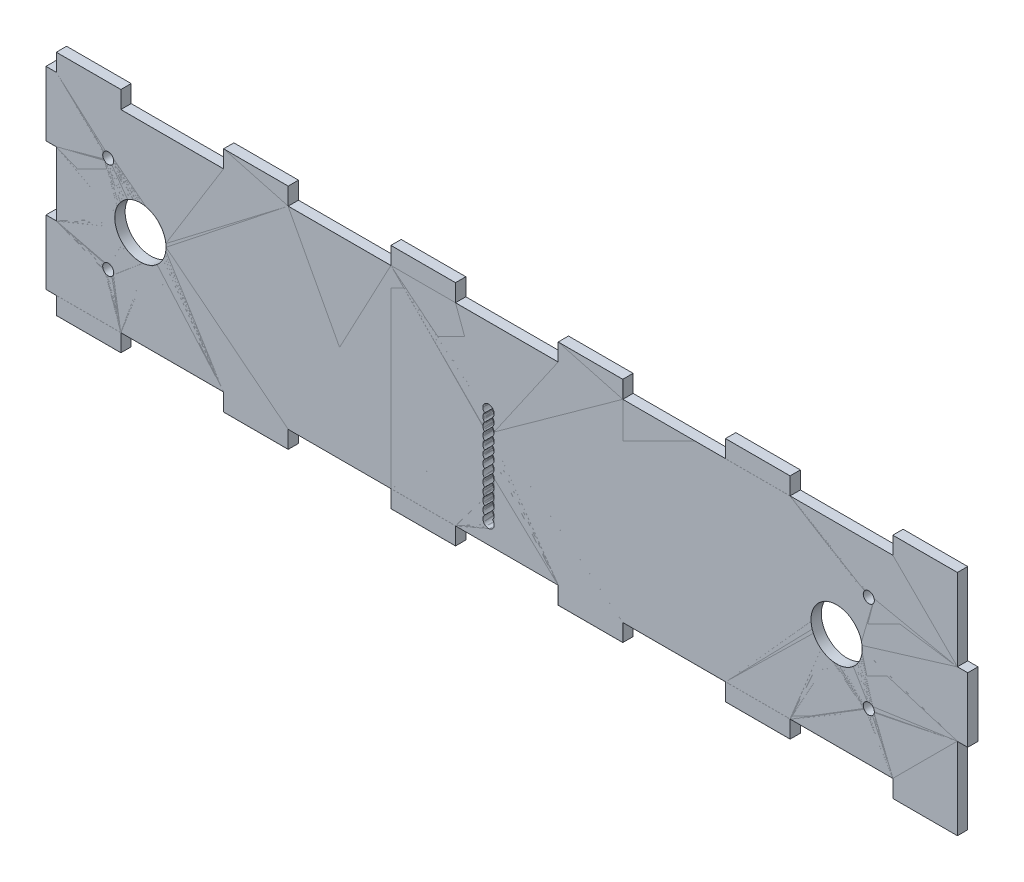
from build123d import *

# Parameters (mm, degrees)
BOSS_EXTRUDE1_OUTLINE_R   = 1.755
BOSS_EXTRUDE1_OUTLINE_R_2 = 8
BOSS_EXTRUDE1_DEPTH       = 3.175
SKETCH4_R                 = 1.71436
SKETCH4_R_2               = 7.95936
BOSS_EXTRUDE3_DEPTH       = 3.2


# Read off the part's stored shape, not the designer's step: Boss-Extrude1
with BuildPart() as part:
    # Boss-Extrude1 outline → Boss-Extrude1 (new body)
    with BuildSketch(Plane.XY):
        Polygon((-140, 35.4), (-140, 30), (-143.2, 30), (-143.2, 10), (-140, 10), (-140, -10), (-143.2, -10), (-143.2, -30), (-140, -30), (-140, -35.4), (-120, -35.4), (-120, -30), (-88, -30), (-88, -35.4), (-68, -35.4), (-68, -30), (-36, -30), (-36, -35.4), (-16, -35.4), (-16, -30), (16, -30), (16, -35.4), (36, -35.4), (36, -30), (68, -30), (68, -35.4), (88, -35.4), (88, -30), (120, -30), (120, -35.4), (140, -35.4), (140, -10), (143.2, -10), (143.2, 10), (140, 10), (140, 35.4), (120, 35.4), (120, 30), (88, 30), (88, 35.4), (68, 35.4), (68, 30), (36, 30), (36, 35.4), (16, 35.4), (16, 30), (-16, 30), (-16, 35.4), (-36, 35.4), (-36, 30), (-68, 30), (-68, 35.4), (-88, 35.4), (-88, 30), (-120, 30), (-120, 35.4), align=None)
        with Locations((-123.9, -15)):
            Circle(BOSS_EXTRUDE1_OUTLINE_R, mode=Mode.SUBTRACT)
        with BuildLine():
            ThreePointArc((-4.475255129, -20.1), (-3.95, -21.35), (-4.475255129, -22.6))
            ThreePointArc((-4.475255129, -22.6), (-5.7, -25.6), (-6.924744871, -22.6))
            ThreePointArc((-6.924744871, -22.6), (-7.45, -21.35), (-6.924744871, -20.1))
            ThreePointArc((-6.924744871, -20.1), (-7.45, -18.85), (-6.924744871, -17.6))
            ThreePointArc((-6.924744871, -17.6), (-7.45, -16.35), (-6.924744871, -15.1))
            ThreePointArc((-6.924744871, -15.1), (-7.45, -13.85), (-6.924744871, -12.6))
            ThreePointArc((-6.924744871, -12.6), (-7.45, -11.35), (-6.924744871, -10.1))
            ThreePointArc((-6.924744871, -10.1), (-7.45, -8.85), (-6.924744871, -7.6))
            ThreePointArc((-6.924744871, -7.6), (-7.45, -6.35), (-6.924744871, -5.1))
            ThreePointArc((-6.924744871, -5.1), (-7.45, -3.85), (-6.924744871, -2.6))
            ThreePointArc((-6.924744871, -2.6), (-7.45, -1.35), (-6.924744871, -0.1))
            ThreePointArc((-6.924744871, -0.1), (-7.45, 1.15), (-6.924744871, 2.4))
            ThreePointArc((-6.924744871, 2.4), (-7.45, 3.65), (-6.924744871, 4.9))
            ThreePointArc((-6.924744871, 4.9), (-5.7, 7.9), (-4.475255129, 4.9))
            ThreePointArc((-4.475255129, 4.9), (-3.95, 3.65), (-4.475255129, 2.4))
            ThreePointArc((-4.475255129, 2.4), (-3.95, 1.15), (-4.475255129, -0.1))
            ThreePointArc((-4.475255129, -0.1), (-3.95, -1.35), (-4.475255129, -2.6))
            ThreePointArc((-4.475255129, -2.6), (-3.95, -3.85), (-4.475255129, -5.1))
            ThreePointArc((-4.475255129, -5.1), (-3.95, -6.35), (-4.475255129, -7.6))
            ThreePointArc((-4.475255129, -7.6), (-3.95, -8.85), (-4.475255129, -10.1))
            ThreePointArc((-4.475255129, -10.1), (-3.95, -11.35), (-4.475255129, -12.6))
            ThreePointArc((-4.475255129, -12.6), (-3.95, -13.85), (-4.475255129, -15.1))
            ThreePointArc((-4.475255129, -15.1), (-3.95, -16.35), (-4.475255129, -17.6))
            ThreePointArc((-4.475255129, -17.6), (-3.95, -18.85), (-4.475255129, -20.1))
        make_face(mode=Mode.SUBTRACT)
        with Locations((112.5, -15)):
            Circle(BOSS_EXTRUDE1_OUTLINE_R, mode=Mode.SUBTRACT)
        with Locations((-113.9, 0)):
            Circle(BOSS_EXTRUDE1_OUTLINE_R_2, mode=Mode.SUBTRACT)
        with Locations((-123.9, 15)):
            Circle(BOSS_EXTRUDE1_OUTLINE_R, mode=Mode.SUBTRACT)
        with Locations((102.5, 0)):
            Circle(BOSS_EXTRUDE1_OUTLINE_R_2, mode=Mode.SUBTRACT)
        with Locations((112.5, 15)):
            Circle(BOSS_EXTRUDE1_OUTLINE_R, mode=Mode.SUBTRACT)
    extrude(amount=BOSS_EXTRUDE1_DEPTH)


with BuildPart() as body_2:
    # Sketch4 → Boss-Extrude3 (new body)
    with BuildSketch(Plane.XY.offset(3.175)):
        Polygon((140.04064, 10.04064), (140.04064, 35.44064), (119.95936, 35.44064), (119.95936, 30.04064), (88.04064, 30.04064), (88.04064, 35.44064), (67.95936, 35.44064), (67.95936, 30.04064), (36.04064, 30.04064), (36.04064, 35.44064), (15.95936, 35.44064), (15.95936, 30.04064), (-15.95936, 30.04064), (-15.95936, 35.44064), (-36.04064, 35.44064), (-36.04064, 30.04064), (-67.95936, 30.04064), (-67.95936, 35.44064), (-88.04064, 35.44064), (-88.04064, 30.04064), (-119.95936, 30.04064), (-119.95936, 35.44064), (-140.04064, 35.44064), (-140.04064, 30.04064), (-143.24064, 30.04064), (-143.24064, 9.95936), (-140.04064, 9.95936), (-140.04064, -9.95936), (-143.24064, -9.95936), (-143.24064, -30.04064), (-140.04064, -30.04064), (-140.04064, -35.44064), (-119.95936, -35.44064), (-119.95936, -30.04064), (-88.04064, -30.04064), (-88.04064, -35.44064), (-67.95936, -35.44064), (-67.95936, -30.04064), (-36.04064, -30.04064), (-36.04064, -35.44064), (-15.95936, -35.44064), (-15.95936, -30.04064), (15.95936, -30.04064), (15.95936, -35.44064), (36.04064, -35.44064), (36.04064, -30.04064), (67.95936, -30.04064), (67.95936, -35.44064), (88.04064, -35.44064), (88.04064, -30.04064), (119.95936, -30.04064), (119.95936, -35.44064), (140.04064, -35.44064), (140.04064, -10.04064), (143.24064, -10.04064), (143.24064, 10.04064), align=None)
        with Locations((-123.9, 15)):
            Circle(SKETCH4_R, mode=Mode.SUBTRACT)
        with Locations((-113.9, 0)):
            Circle(SKETCH4_R_2, mode=Mode.SUBTRACT)
        with Locations((-123.9, -15)):
            Circle(SKETCH4_R, mode=Mode.SUBTRACT)
        with Locations((102.5, 0)):
            Circle(SKETCH4_R_2, mode=Mode.SUBTRACT)
        with Locations((112.5, 15)):
            Circle(SKETCH4_R, mode=Mode.SUBTRACT)
        with Locations((112.5, -15)):
            Circle(SKETCH4_R, mode=Mode.SUBTRACT)
        with BuildLine():
            ThreePointArc((-4.475255129, 4.9), (-5.7, 7.9), (-6.924744871, 4.9))
            ThreePointArc((-6.924744871, 4.9), (-7.45, 3.65), (-6.924744871, 2.4))
            ThreePointArc((-6.924744871, 2.4), (-7.45, 1.15), (-6.924744871, -0.1))
            ThreePointArc((-6.924744871, -0.1), (-7.45, -1.35), (-6.924744871, -2.6))
            ThreePointArc((-6.924744871, -2.6), (-7.45, -3.85), (-6.924744871, -5.1))
            ThreePointArc((-6.924744871, -5.1), (-7.45, -6.35), (-6.924744871, -7.6))
            ThreePointArc((-6.924744871, -7.6), (-7.45, -8.85), (-6.924744871, -10.1))
            ThreePointArc((-6.924744871, -10.1), (-7.45, -11.35), (-6.924744871, -12.6))
            ThreePointArc((-6.924744871, -12.6), (-7.45, -13.85), (-6.924744871, -15.1))
            ThreePointArc((-6.924744871, -15.1), (-7.45, -16.35), (-6.924744871, -17.6))
            ThreePointArc((-6.924744871, -17.6), (-7.45, -18.85), (-6.924744871, -20.1))
            ThreePointArc((-6.924744871, -20.1), (-7.45, -21.35), (-6.924744871, -22.6))
            ThreePointArc((-6.924744871, -22.6), (-5.7, -25.6), (-4.475255129, -22.6))
            ThreePointArc((-4.475255129, -22.6), (-3.95, -21.35), (-4.475255129, -20.1))
            ThreePointArc((-4.475255129, -20.1), (-3.95, -18.85), (-4.475255129, -17.6))
            ThreePointArc((-4.475255129, -17.6), (-3.95, -16.35), (-4.475255129, -15.1))
            ThreePointArc((-4.475255129, -15.1), (-3.95, -13.85), (-4.475255129, -12.6))
            ThreePointArc((-4.475255129, -12.6), (-3.95, -11.35), (-4.475255129, -10.1))
            ThreePointArc((-4.475255129, -10.1), (-3.95, -8.85), (-4.475255129, -7.6))
            ThreePointArc((-4.475255129, -7.6), (-3.95, -6.35), (-4.475255129, -5.1))
            ThreePointArc((-4.475255129, -5.1), (-3.95, -3.85), (-4.475255129, -2.6))
            ThreePointArc((-4.475255129, -2.6), (-3.95, -1.35), (-4.475255129, -0.1))
            ThreePointArc((-4.475255129, -0.1), (-3.95, 1.15), (-4.475255129, 2.4))
            ThreePointArc((-4.475255129, 2.4), (-3.95, 3.65), (-4.475255129, 4.9))
        make_face(mode=Mode.SUBTRACT)
    extrude(amount=-BOSS_EXTRUDE3_DEPTH)


solid = Compound([part.part, body_2.part])
